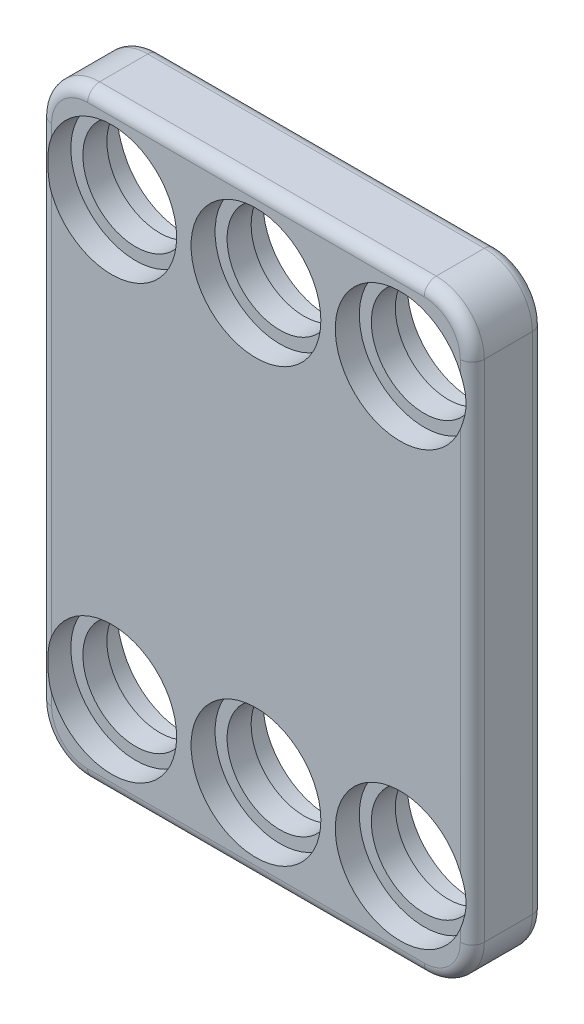
from build123d import *

# Parameters (mm, degrees)
SKETCH1_W           = 18
SKETCH1_H           = 25
BOSS_EXTRUDE1_DEPTH = 3
HOLE1_D             = 4.4
HOLE1_DEPTH         = 100
HOLE1_CBORE_D       = 5.4
HOLE1_CBORE_DEPTH   = 1
HOLE2_D             = 4.4
HOLE2_DEPTH         = 100
HOLE2_CBORE_D       = 5.4
HOLE2_CBORE_DEPTH   = 1
FILLET1_R           = 2
FILLET2_R           = 0.5


with BuildPart() as part:
    # Sketch1 → Boss-Extrude1 (new body)
    with BuildSketch(Plane.XY):
        with Locations((0, -9)):
            Rectangle(SKETCH1_W, SKETCH1_H)
    extrude(amount=BOSS_EXTRUDE1_DEPTH)

    # Hole1
    with Locations(Plane.XY.offset(3)):
        with Locations((-6, 0), (0, 0), (6, 0), (-6, -18), (0, -18), (6, -18)):
            CounterBoreHole(HOLE1_D / 2, HOLE1_CBORE_D / 2, HOLE1_CBORE_DEPTH, depth=HOLE1_DEPTH)

    # Hole2
    with Locations(Plane(origin=(0, 0, 0), x_dir=(-1, 0, 0), z_dir=(0, 0, -1))):
        with Locations((-6, 0), (0, 0), (6, 0), (6, -18), (0, -18), (-6, -18)):
            CounterBoreHole(HOLE2_D / 2, HOLE2_CBORE_D / 2, HOLE2_CBORE_DEPTH, depth=HOLE2_DEPTH)

    # Fillet1
    fillet1_edges = [part.edges().sort_by_distance(p)[0] for p in [
        (9, -21.5, 1.5),
        (-9, -21.5, 1.5),
        (-9, 3.5, 1.5),
        (9, 3.5, 1.5),
    ]]
    fillet(fillet1_edges, radius=FILLET1_R)

    # Fillet2
    # the kernel refuses this fillet: 0.5 mm, written as the material it takes off along each edge
    with BuildSketch(Plane(origin=(9, -19.5, 0), x_dir=(-1, 0, 0), z_dir=(0, 1, 0)), Plane(origin=(-9, 1.5, 0), x_dir=(1, 0, 0), z_dir=(0, -1, 0))) as fillet2_piece_1:
        with BuildLine():
            CenterArc((FILLET2_R, FILLET2_R), FILLET2_R, 180, 90)
            Line((0, FILLET2_R), (0, 0))
            Line((0, 0), (FILLET2_R, 0))
        make_face()
    extrude(amount=21, mode=Mode.SUBTRACT)
    with BuildSketch(Plane(origin=(9, -19.5, 3), x_dir=(-1, 0, 0), z_dir=(0, 1, 0)), Plane(origin=(-9, 1.5, 3), x_dir=(1, 0, 0), z_dir=(0, -1, 0))) as fillet2_piece_2:
        with BuildLine():
            CenterArc((FILLET2_R, -FILLET2_R), FILLET2_R, 90, 90)
            Line((0, -FILLET2_R), (0, 0))
            Line((0, 0), (FILLET2_R, 0))
        make_face()
    extrude(amount=21, mode=Mode.SUBTRACT)
    with BuildSketch(Plane(origin=(-7, -21.5, 0), x_dir=(0, 1, 0), z_dir=(1, 0, 0)), Plane(origin=(7, 3.5, 3), x_dir=(0, 0, -1), z_dir=(-1, 0, 0))) as fillet2_piece_3:
        with BuildLine():
            CenterArc((FILLET2_R, FILLET2_R), FILLET2_R, 180, 90)
            Line((0, FILLET2_R), (0, 0))
            Line((0, 0), (FILLET2_R, 0))
        make_face()
    extrude(amount=14, mode=Mode.SUBTRACT)
    with BuildSketch(Plane(origin=(7, 3.5, 0), x_dir=(0, 0, 1), z_dir=(-1, 0, 0)), Plane(origin=(-7, -21.5, 3), x_dir=(0, 1, 0), z_dir=(1, 0, 0))) as fillet2_piece_4:
        with BuildLine():
            CenterArc((FILLET2_R, -FILLET2_R), FILLET2_R, 90, 90)
            Line((0, -FILLET2_R), (0, 0))
            Line((0, 0), (FILLET2_R, 0))
        make_face()
    extrude(amount=14, mode=Mode.SUBTRACT)
    with BuildSketch(Plane(origin=(7, 1.5, 0), x_dir=(0, 1, 0), z_dir=(-1, 0, 0))) as fillet2_piece_5:
        with BuildLine():
            CenterArc((2 - FILLET2_R, -FILLET2_R), FILLET2_R, 0, 90)
            Line((2, -FILLET2_R), (2, 0))
            Line((2, 0), (2 - FILLET2_R, 0))
        make_face()
    revolve(axis=Axis((7, 1.5, 0), (0, 0, -1)), revolution_arc=90, mode=Mode.SUBTRACT)
    with BuildSketch(Plane(origin=(-7, 1.5, 0), x_dir=(0, 1, 0), z_dir=(1, 0, 0))) as fillet2_piece_6:
        with BuildLine():
            CenterArc((2 - FILLET2_R, FILLET2_R), FILLET2_R, 270, 90)
            Line((2, FILLET2_R), (2, 0))
            Line((2, 0), (2 - FILLET2_R, 0))
        make_face()
    revolve(axis=Axis((-7, 1.5, 0), (0, 0, 1)), revolution_arc=90, mode=Mode.SUBTRACT)
    with BuildSketch(Plane(origin=(-7, -19.5, 0), x_dir=(0, -1, 0), z_dir=(1, 0, 0))) as fillet2_piece_7:
        with BuildLine():
            CenterArc((2 - FILLET2_R, -FILLET2_R), FILLET2_R, 0, 90)
            Line((2, -FILLET2_R), (2, 0))
            Line((2, 0), (2 - FILLET2_R, 0))
        make_face()
    revolve(axis=Axis((-7, -19.5, 0), (0, 0, -1)), revolution_arc=90, mode=Mode.SUBTRACT)
    with BuildSketch(Plane(origin=(7, -19.5, 0), x_dir=(0, -1, 0), z_dir=(-1, 0, 0))) as fillet2_piece_8:
        with BuildLine():
            CenterArc((2 - FILLET2_R, FILLET2_R), FILLET2_R, 270, 90)
            Line((2, FILLET2_R), (2, 0))
            Line((2, 0), (2 - FILLET2_R, 0))
        make_face()
    revolve(axis=Axis((7, -19.5, 0), (0, 0, 1)), revolution_arc=90, mode=Mode.SUBTRACT)
    with BuildSketch(Plane(origin=(7, 1.5, 3), x_dir=(0, 1, 0), z_dir=(-1, 0, 0))) as fillet2_piece_9:
        with BuildLine():
            CenterArc((2 - FILLET2_R, FILLET2_R), FILLET2_R, 270, 90)
            Line((2 - FILLET2_R, 0), (2, 0))
            Line((2, 0), (2, FILLET2_R))
        make_face()
    revolve(axis=Axis((7, 1.5, 3), (0, 0, -1)), revolution_arc=90, mode=Mode.SUBTRACT)
    with BuildSketch(Plane(origin=(-7, 1.5, 3), x_dir=(0, 1, 0), z_dir=(1, 0, 0))) as fillet2_piece_10:
        with BuildLine():
            CenterArc((2 - FILLET2_R, -FILLET2_R), FILLET2_R, 0, 90)
            Line((2 - FILLET2_R, 0), (2, 0))
            Line((2, 0), (2, -FILLET2_R))
        make_face()
    revolve(axis=Axis((-7, 1.5, 3), (0, 0, 1)), revolution_arc=90, mode=Mode.SUBTRACT)
    with BuildSketch(Plane(origin=(-7, -19.5, 3), x_dir=(0, -1, 0), z_dir=(1, 0, 0))) as fillet2_piece_11:
        with BuildLine():
            CenterArc((2 - FILLET2_R, FILLET2_R), FILLET2_R, 270, 90)
            Line((2, FILLET2_R), (2, 0))
            Line((2, 0), (2 - FILLET2_R, 0))
        make_face()
    revolve(axis=Axis((-7, -19.5, 3), (0, 0, -1)), revolution_arc=90, mode=Mode.SUBTRACT)
    with BuildSketch(Plane(origin=(7, -19.5, 3), x_dir=(0, -1, 0), z_dir=(-1, 0, 0))) as fillet2_piece_12:
        with BuildLine():
            CenterArc((2 - FILLET2_R, -FILLET2_R), FILLET2_R, 0, 90)
            Line((2, -FILLET2_R), (2, 0))
            Line((2, 0), (2 - FILLET2_R, 0))
        make_face()
    revolve(axis=Axis((7, -19.5, 3), (0, 0, 1)), revolution_arc=90, mode=Mode.SUBTRACT)


solid = part.part
